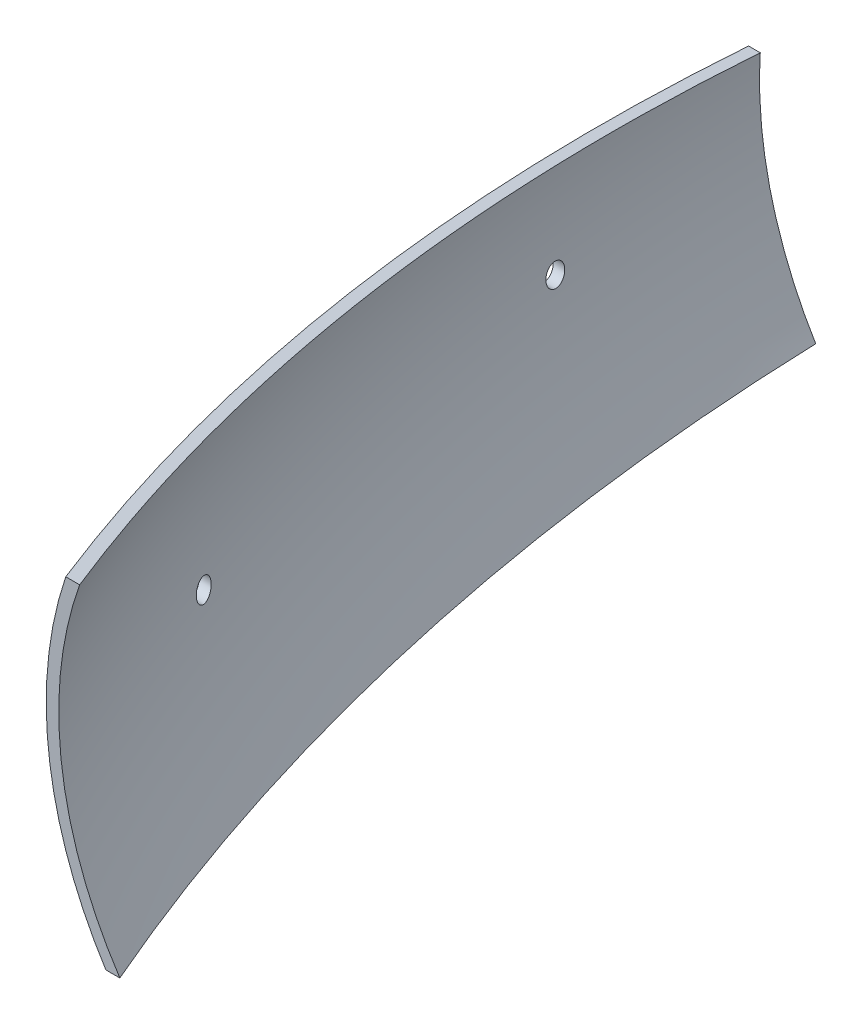
from build123d import *

# Parameters (mm, degrees)
REVOLVE1_ANGLE          = 88
CUT_EXTRUDE2_DEPTH      = 2771.780439466
CUT_EXTRUDE2_DEPTH_BACK = 2771.780439466
SKETCH5_W               = 5800.528681758
SKETCH5_H               = 2435.889164845
CUT_EXTRUDE4_DEPTH      = 838.656303446
CUT_EXTRUDE4_DEPTH_BACK = 838.656303446
SKETCH6_R               = 8.3125


with BuildPart() as part:
    # Sketch2 → Revolve1 (revolve)
    with BuildSketch(Plane.XY):
        with BuildLine():
            Line((72.370392529, 0), (82.370392529, 0))
            ThreePointArc((82.370392529, 0), (40.524594063, 121.838677192), (53.578690935, 250))
            Line((53.578690935, 250), (43.578690935, 250))
            ThreePointArc((43.578690935, 250), (31.595154891, 121.961970263), (72.370392529, 0))
        make_face()
    revolve(axis=Axis((2000, -13.371705106, 0), (0, 1, 0)), revolution_arc=REVOLVE1_ANGLE)

    # Sketch5 → Cut-Extrude2 (cut, two sides: drawn at the far end of the back side and taken through both)
    with BuildSketch(Plane(origin=(0, 0, 0), x_dir=(0, 0, -1), z_dir=(1, 0, 0)).offset(-CUT_EXTRUDE2_DEPTH_BACK)):
        with Locations((76.037885341, -87.116535175)):
            Rectangle(SKETCH5_W, SKETCH5_H)
        Polygon((-762.459239957, 250), (-762.459239957, 0), (-62.459239957, 0), (-62.459239957, 175), align=None, mode=Mode.SUBTRACT)
    extrude(amount=CUT_EXTRUDE2_DEPTH + CUT_EXTRUDE2_DEPTH_BACK, mode=Mode.SUBTRACT)

    # Sketch6 → Cut-Extrude4 (cut, two sides: drawn at the far end of the back side and taken through both)
    with BuildSketch(Plane(origin=(0, 0, 0), x_dir=(0, 0, -1), z_dir=(1, 0, 0)).offset(-CUT_EXTRUDE4_DEPTH_BACK)):
        with Locations((-587.459239957, 120)):
            Circle(SKETCH6_R)
        with Locations((-237.459239957, 120)):
            Circle(SKETCH6_R)
    extrude(amount=CUT_EXTRUDE4_DEPTH + CUT_EXTRUDE4_DEPTH_BACK, mode=Mode.SUBTRACT)


solid = part.part
